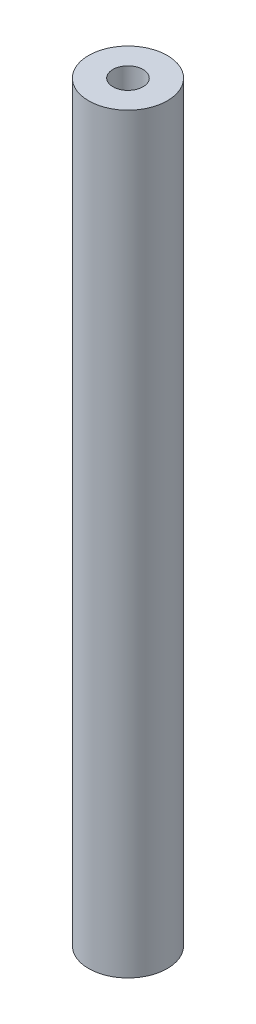
from build123d import *

# Parameters (mm, degrees)
SKETCH1_R           = 3
SKETCH1_R_2         = 1.15
BOSS_EXTRUDE1_DEPTH = 57.33


with BuildPart() as part:
    # Sketch1 → Boss-Extrude1 (new body)
    with BuildSketch(Plane(origin=(0, 0, 0), x_dir=(1, 0, 0), z_dir=(0, 1, 0))):
        Circle(SKETCH1_R)
        Circle(SKETCH1_R_2, mode=Mode.SUBTRACT)
    extrude(amount=BOSS_EXTRUDE1_DEPTH)


solid = part.part
